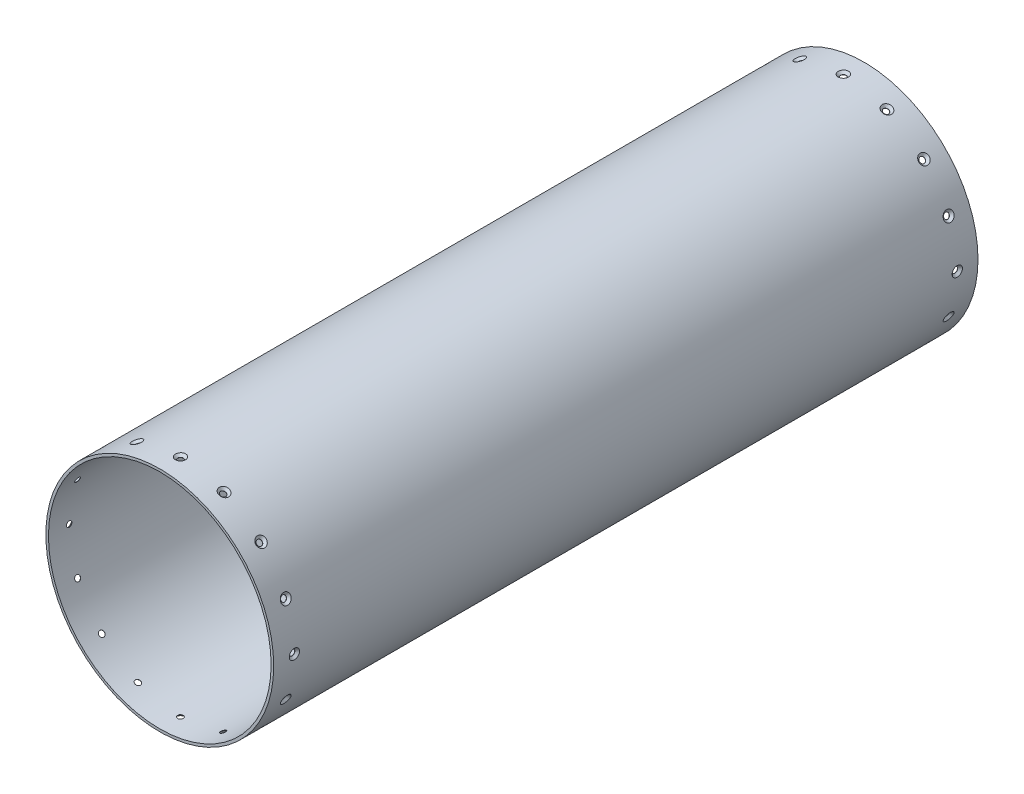
from build123d import *

# Parameters (mm, degrees)
SKETCH1_R                                       = 69.85
SKETCH1_R_2                                     = 68.2625
EXTRUDE1_DEPTH                                  = 431.8
CSK_FOR_M3_FLAT_HEAD_MACHINE_SCREW1_D           = 3.4
CSK_FOR_M3_FLAT_HEAD_MACHINE_SCREW1_CSINK_D     = 6.3
CSK_FOR_M3_FLAT_HEAD_MACHINE_SCREW1_CSINK_ANGLE = 90
CIRPATTERN1_COUNT                               = 16
LPATTERN1_COPY_1_D                              = 3.4
LPATTERN1_COPY_1_CSINK_D                        = 6.3
LPATTERN1_COPY_1_CSINK_ANGLE                    = 90
LPATTERN1_COPY_2_D                              = 3.4
LPATTERN1_COPY_2_CSINK_D                        = 6.3
LPATTERN1_COPY_2_CSINK_ANGLE                    = 90
LPATTERN1_COPY_3_D                              = 3.4
LPATTERN1_COPY_3_CSINK_D                        = 6.3
LPATTERN1_COPY_3_CSINK_ANGLE                    = 90
LPATTERN1_COPY_4_D                              = 3.4
LPATTERN1_COPY_4_CSINK_D                        = 6.3
LPATTERN1_COPY_4_CSINK_ANGLE                    = 90
LPATTERN1_COPY_5_D                              = 3.4
LPATTERN1_COPY_5_CSINK_D                        = 6.3
LPATTERN1_COPY_5_CSINK_ANGLE                    = 90
LPATTERN1_COPY_6_D                              = 3.4
LPATTERN1_COPY_6_CSINK_D                        = 6.3
LPATTERN1_COPY_6_CSINK_ANGLE                    = 90
LPATTERN1_COPY_7_D                              = 3.4
LPATTERN1_COPY_7_CSINK_D                        = 6.3
LPATTERN1_COPY_7_CSINK_ANGLE                    = 90
LPATTERN1_COPY_8_D                              = 3.4
LPATTERN1_COPY_8_CSINK_D                        = 6.3
LPATTERN1_COPY_8_CSINK_ANGLE                    = 90
LPATTERN1_COPY_9_D                              = 3.4
LPATTERN1_COPY_9_CSINK_D                        = 6.3
LPATTERN1_COPY_9_CSINK_ANGLE                    = 90
LPATTERN1_COPY_10_D                             = 3.4
LPATTERN1_COPY_10_CSINK_D                       = 6.3
LPATTERN1_COPY_10_CSINK_ANGLE                   = 90
LPATTERN1_COPY_11_D                             = 3.4
LPATTERN1_COPY_11_CSINK_D                       = 6.3
LPATTERN1_COPY_11_CSINK_ANGLE                   = 90
LPATTERN1_COPY_12_D                             = 3.4
LPATTERN1_COPY_12_CSINK_D                       = 6.3
LPATTERN1_COPY_12_CSINK_ANGLE                   = 90
LPATTERN1_COPY_13_D                             = 3.4
LPATTERN1_COPY_13_CSINK_D                       = 6.3
LPATTERN1_COPY_13_CSINK_ANGLE                   = 90
LPATTERN1_COPY_14_D                             = 3.4
LPATTERN1_COPY_14_CSINK_D                       = 6.3
LPATTERN1_COPY_14_CSINK_ANGLE                   = 90
LPATTERN1_COPY_15_D                             = 3.4
LPATTERN1_COPY_15_CSINK_D                       = 6.3
LPATTERN1_COPY_15_CSINK_ANGLE                   = 90
LPATTERN1_COPY_16_D                             = 3.4
LPATTERN1_COPY_16_CSINK_D                       = 6.3
LPATTERN1_COPY_16_CSINK_ANGLE                   = 90


with BuildPart() as part:
    # Sketch1 → Extrude1 (new body)
    with BuildSketch(Plane.XY):
        Circle(SKETCH1_R)
        Circle(SKETCH1_R_2, mode=Mode.SUBTRACT)
    extrude(amount=EXTRUDE1_DEPTH)

    # CSK for M3 Flat Head Machine Screw1 (through all)
    with Locations(Plane(origin=(0, -69.85, 12.7), x_dir=(1, 0, 0), z_dir=(0, -1, 0))):
        with Locations((0, 0)):
            csk_for_m3_flat_head_machine_screw1 = CounterSinkHole(CSK_FOR_M3_FLAT_HEAD_MACHINE_SCREW1_D / 2, CSK_FOR_M3_FLAT_HEAD_MACHINE_SCREW1_CSINK_D / 2, counter_sink_angle=CSK_FOR_M3_FLAT_HEAD_MACHINE_SCREW1_CSINK_ANGLE)

    # CirPattern1: CSK for M3 Flat Head Machine Screw1 ×16 about axis
    cirpattern1_axis = Axis((0, 0, 431.8), (0, 0, -1))
    for i in range(1, CIRPATTERN1_COUNT):
        add(csk_for_m3_flat_head_machine_screw1.rotate(cirpattern1_axis, i * 360 / CIRPATTERN1_COUNT), mode=Mode.SUBTRACT)

    # LPattern1 copy 1 (through all)
    with Locations(Plane(origin=(-26.730437751, -64.532985346, 419.1), x_dir=(0.9238795325112867, -0.3826834323650898, 0), z_dir=(-0.3826834323650898, -0.9238795325112867, 0))):
        with Locations((0, 0)):
            CounterSinkHole(LPATTERN1_COPY_1_D / 2, LPATTERN1_COPY_1_CSINK_D / 2, counter_sink_angle=LPATTERN1_COPY_1_CSINK_ANGLE)

    # LPattern1 copy 2 (through all)
    with Locations(Plane(origin=(-49.391408666, -49.391408666, 419.1), x_dir=(0.7071067811865476, -0.7071067811865475, 0), z_dir=(-0.7071067811865475, -0.7071067811865476, 0))):
        with Locations((0, 0)):
            CounterSinkHole(LPATTERN1_COPY_2_D / 2, LPATTERN1_COPY_2_CSINK_D / 2, counter_sink_angle=LPATTERN1_COPY_2_CSINK_ANGLE)

    # LPattern1 copy 3 (through all)
    with Locations(Plane(origin=(-64.532985346, -26.730437751, 419.1), x_dir=(0.38268343236508984, -0.9238795325112867, 0), z_dir=(-0.9238795325112867, -0.38268343236508984, 0))):
        with Locations((0, 0)):
            CounterSinkHole(LPATTERN1_COPY_3_D / 2, LPATTERN1_COPY_3_CSINK_D / 2, counter_sink_angle=LPATTERN1_COPY_3_CSINK_ANGLE)

    # LPattern1 copy 4 (through all)
    with Locations(Plane(origin=(-69.85, 0, 419.1), x_dir=(0, -1, 0), z_dir=(-1, 0, 0))):
        with Locations((0, 0)):
            CounterSinkHole(LPATTERN1_COPY_4_D / 2, LPATTERN1_COPY_4_CSINK_D / 2, counter_sink_angle=LPATTERN1_COPY_4_CSINK_ANGLE)

    # LPattern1 copy 5 (through all)
    with Locations(Plane(origin=(-64.532985346, 26.730437751, 419.1), x_dir=(-0.3826834323650897, -0.9238795325112867, 0), z_dir=(-0.9238795325112867, 0.3826834323650897, 0))):
        with Locations((0, 0)):
            CounterSinkHole(LPATTERN1_COPY_5_D / 2, LPATTERN1_COPY_5_CSINK_D / 2, counter_sink_angle=LPATTERN1_COPY_5_CSINK_ANGLE)

    # LPattern1 copy 6 (through all)
    with Locations(Plane(origin=(-49.391408666, 49.391408666, 419.1), x_dir=(-0.7071067811865475, -0.7071067811865476, 0), z_dir=(-0.7071067811865476, 0.7071067811865475, 0))):
        with Locations((0, 0)):
            CounterSinkHole(LPATTERN1_COPY_6_D / 2, LPATTERN1_COPY_6_CSINK_D / 2, counter_sink_angle=LPATTERN1_COPY_6_CSINK_ANGLE)

    # LPattern1 copy 7 (through all)
    with Locations(Plane(origin=(-26.730437751, 64.532985346, 419.1), x_dir=(-0.9238795325112867, -0.3826834323650899, 0), z_dir=(-0.3826834323650899, 0.9238795325112867, 0))):
        with Locations((0, 0)):
            CounterSinkHole(LPATTERN1_COPY_7_D / 2, LPATTERN1_COPY_7_CSINK_D / 2, counter_sink_angle=LPATTERN1_COPY_7_CSINK_ANGLE)

    # LPattern1 copy 8 (through all)
    with Locations(Plane(origin=(0, 69.85, 419.1), x_dir=(-1, 0, 0), z_dir=(0, 1, 0))):
        with Locations((0, 0)):
            CounterSinkHole(LPATTERN1_COPY_8_D / 2, LPATTERN1_COPY_8_CSINK_D / 2, counter_sink_angle=LPATTERN1_COPY_8_CSINK_ANGLE)

    # LPattern1 copy 9 (through all)
    with Locations(Plane(origin=(26.730437751, 64.532985346, 419.1), x_dir=(-0.9238795325112868, 0.38268343236508967, 0), z_dir=(0.38268343236508967, 0.9238795325112868, 0))):
        with Locations((0, 0)):
            CounterSinkHole(LPATTERN1_COPY_9_D / 2, LPATTERN1_COPY_9_CSINK_D / 2, counter_sink_angle=LPATTERN1_COPY_9_CSINK_ANGLE)

    # LPattern1 copy 10 (through all)
    with Locations(Plane(origin=(49.391408666, 49.391408666, 419.1), x_dir=(-0.7071067811865477, 0.7071067811865475, 0), z_dir=(0.7071067811865475, 0.7071067811865477, 0))):
        with Locations((0, 0)):
            CounterSinkHole(LPATTERN1_COPY_10_D / 2, LPATTERN1_COPY_10_CSINK_D / 2, counter_sink_angle=LPATTERN1_COPY_10_CSINK_ANGLE)

    # LPattern1 copy 11 (through all)
    with Locations(Plane(origin=(64.532985346, 26.730437751, 419.1), x_dir=(-0.3826834323650895, 0.9238795325112868, 0), z_dir=(0.9238795325112868, 0.3826834323650895, 0))):
        with Locations((0, 0)):
            CounterSinkHole(LPATTERN1_COPY_11_D / 2, LPATTERN1_COPY_11_CSINK_D / 2, counter_sink_angle=LPATTERN1_COPY_11_CSINK_ANGLE)

    # LPattern1 copy 12 (through all)
    with Locations(Plane(origin=(69.85, 0, 419.1), x_dir=(0, 1, 0), z_dir=(1, 0, 0))):
        with Locations((0, 0)):
            CounterSinkHole(LPATTERN1_COPY_12_D / 2, LPATTERN1_COPY_12_CSINK_D / 2, counter_sink_angle=LPATTERN1_COPY_12_CSINK_ANGLE)

    # LPattern1 copy 13 (through all)
    with Locations(Plane(origin=(64.532985346, -26.730437751, 419.1), x_dir=(0.38268343236509, 0.9238795325112866, 0), z_dir=(0.9238795325112866, -0.38268343236509, 0))):
        with Locations((0, 0)):
            CounterSinkHole(LPATTERN1_COPY_13_D / 2, LPATTERN1_COPY_13_CSINK_D / 2, counter_sink_angle=LPATTERN1_COPY_13_CSINK_ANGLE)

    # LPattern1 copy 14 (through all)
    with Locations(Plane(origin=(49.391408666, -49.391408666, 419.1), x_dir=(0.7071067811865474, 0.7071067811865477, 0), z_dir=(0.7071067811865477, -0.7071067811865474, 0))):
        with Locations((0, 0)):
            CounterSinkHole(LPATTERN1_COPY_14_D / 2, LPATTERN1_COPY_14_CSINK_D / 2, counter_sink_angle=LPATTERN1_COPY_14_CSINK_ANGLE)

    # LPattern1 copy 15 (through all)
    with Locations(Plane(origin=(26.730437751, -64.532985346, 419.1), x_dir=(0.9238795325112868, 0.38268343236508956, 0), z_dir=(0.38268343236508956, -0.9238795325112868, 0))):
        with Locations((0, 0)):
            CounterSinkHole(LPATTERN1_COPY_15_D / 2, LPATTERN1_COPY_15_CSINK_D / 2, counter_sink_angle=LPATTERN1_COPY_15_CSINK_ANGLE)

    # LPattern1 copy 16 (through all)
    with Locations(Plane(origin=(0, -69.85, 419.1), x_dir=(1, 0, 0), z_dir=(0, -1, 0))):
        with Locations((0, 0)):
            CounterSinkHole(LPATTERN1_COPY_16_D / 2, LPATTERN1_COPY_16_CSINK_D / 2, counter_sink_angle=LPATTERN1_COPY_16_CSINK_ANGLE)


solid = part.part
